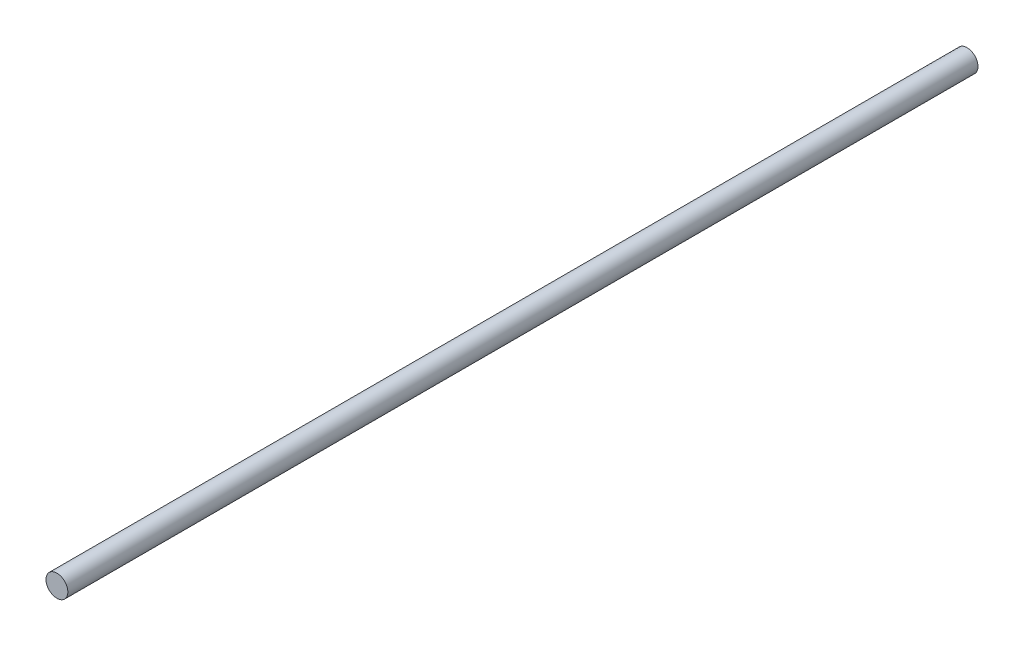
from build123d import *

# Parameters (mm, degrees)
SKETCH1_R           = 3
BOSS_EXTRUDE1_DEPTH = 125


with BuildPart() as part:
    # Sketch1 → Boss-Extrude1 (new, symmetric)
    with BuildSketch(Plane.XY):
        Circle(SKETCH1_R)
    extrude(amount=BOSS_EXTRUDE1_DEPTH, both=True)


solid = part.part
